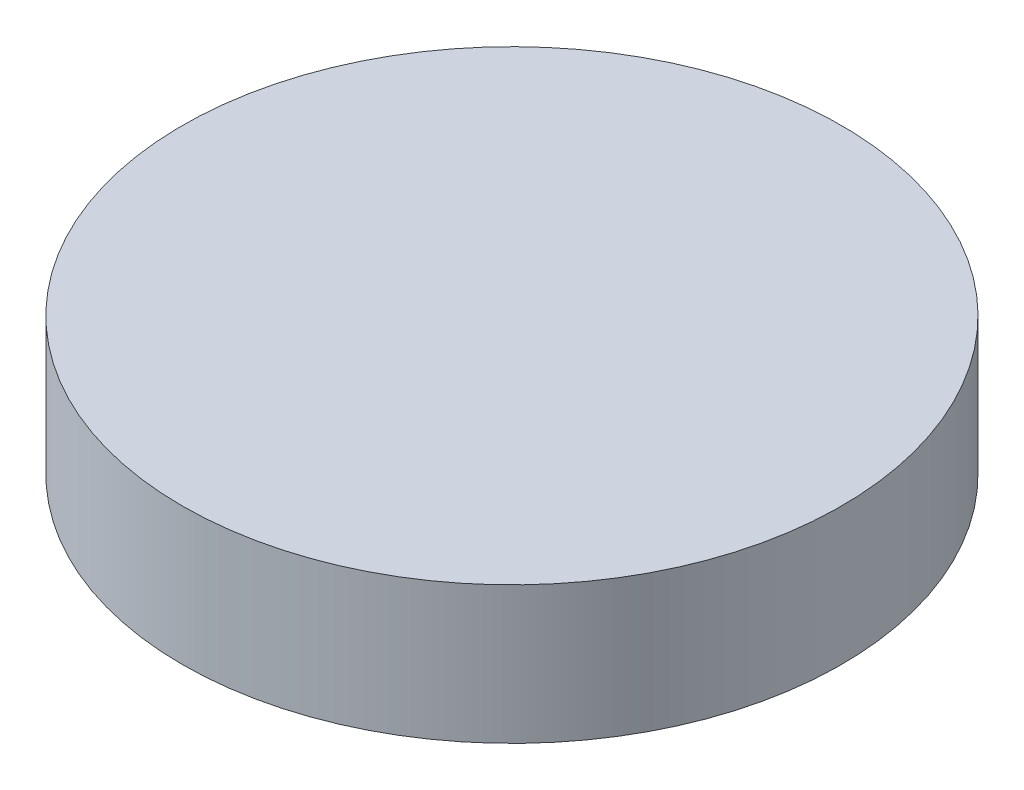
from build123d import *

# Parameters (mm, degrees)
SKETCH1_R           = 24
BOSS_EXTRUDE1_DEPTH = 10


with BuildPart() as part:
    # Sketch1 → Boss-Extrude1 (new body)
    with BuildSketch(Plane(origin=(0, 0, 0), x_dir=(1, 0, 0), z_dir=(0, 1, 0))):
        Circle(SKETCH1_R)
    extrude(amount=BOSS_EXTRUDE1_DEPTH)


solid = part.part
